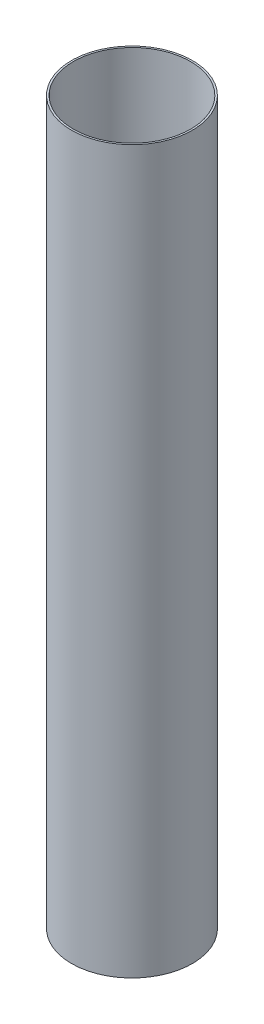
from build123d import *

# Parameters (mm, degrees)
SKETCH1_R           = 67
SKETCH1_R_2         = 65
BOSS_EXTRUDE1_DEPTH = 400


with BuildPart() as part:
    # Sketch1 → Boss-Extrude1 (new, symmetric)
    with BuildSketch(Plane(origin=(0, 0, 0), x_dir=(1, 0, 0), z_dir=(0, 1, 0))):
        Circle(SKETCH1_R)
        Circle(SKETCH1_R_2, mode=Mode.SUBTRACT)
    extrude(amount=BOSS_EXTRUDE1_DEPTH, both=True)


solid = part.part
